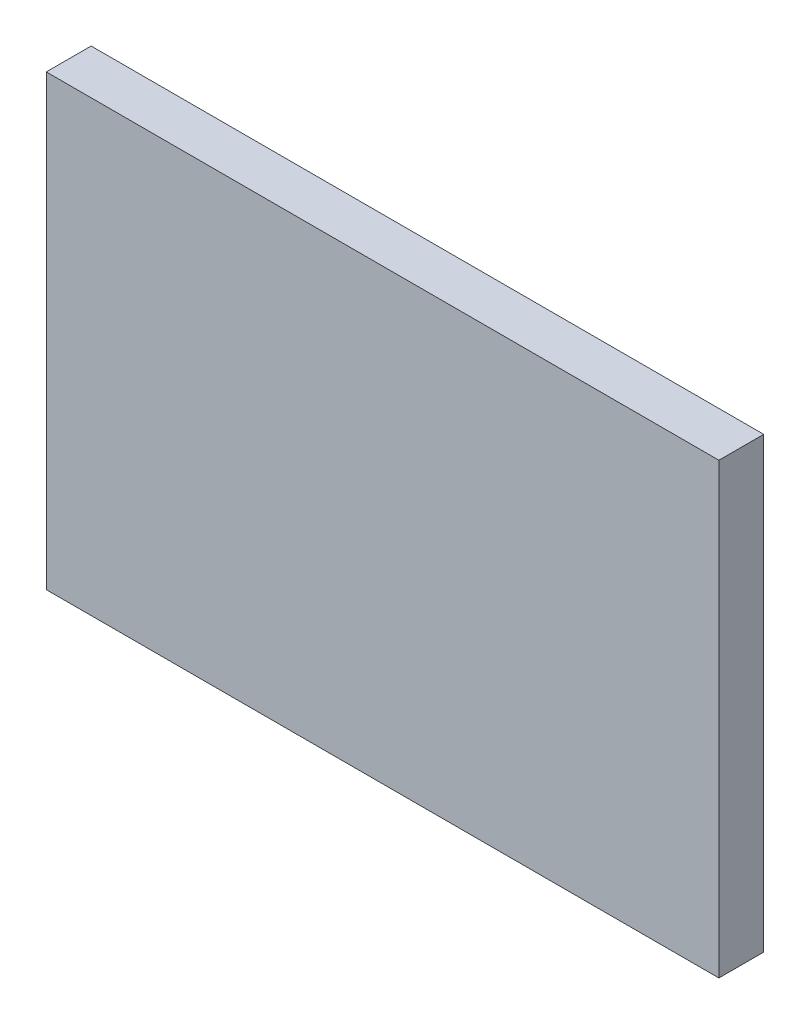
from build123d import *

# Parameters (mm, degrees)
SKETCH_1_W             = 60
SKETCH_1_H             = 40
SM_BASE_FLANGE_1_DEPTH = 4


# Sheet-metal steps are written as plain solids
with BuildPart() as part:
    # Sketch 1 → Базовая кромка1 (new body)
    with BuildSketch(Plane.XY):
        Rectangle(SKETCH_1_W, SKETCH_1_H)
    extrude(amount=-SM_BASE_FLANGE_1_DEPTH)


solid = part.part
